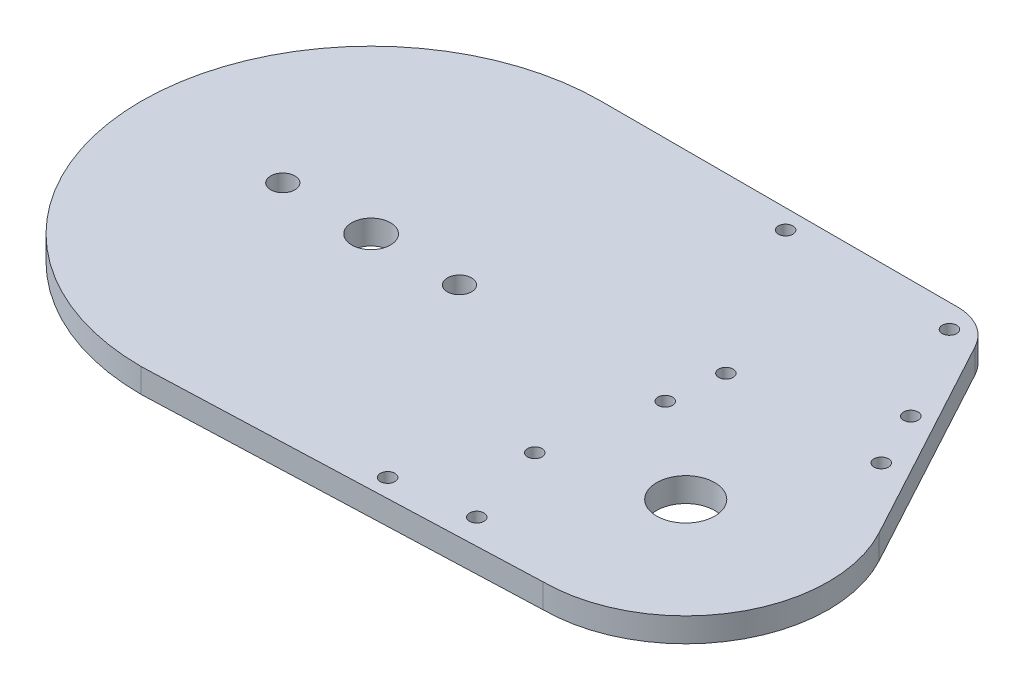
from build123d import *

# Parameters (mm, degrees)
SKETCH1_R           = 4
SKETCH1_R_2         = 1.5
SKETCH1_R_3         = 2.5
SKETCH1_R_4         = 6
BOSS_EXTRUDE1_DEPTH = 5


with BuildPart() as part:
    # Sketch1 → Boss-Extrude1 (new body)
    with BuildSketch(Plane(origin=(0, 0, 0), x_dir=(1, 0, 0), z_dir=(0, 1, 0))):
        with BuildLine():
            Line((0, -47.5), (80, -44.5))
            ThreePointArc((80, -44.5), (105.341650726, -30.101348895), (105.945295539, -0.961067014))
            Line((105.945295539, -0.961067014), (82.559049402, 42.258960334))
            ThreePointArc((82.559049402, 42.258960334), (78.883135286, 46.090390077), (73.764033965, 47.5))
            Line((73.764033965, 47.5), (0, 47.5))
            ThreePointArc((0, 47.5), (-47.5, 0), (0, -47.5))
        make_face()
        Circle(SKETCH1_R, mode=Mode.SUBTRACT)
        with Locations((60.331917451, 0.432644908)):
            Circle(SKETCH1_R_2, mode=Mode.SUBTRACT)
        with Locations((18.25, 0)):
            Circle(SKETCH1_R_3, mode=Mode.SUBTRACT)
        with Locations((-18.25, 0)):
            Circle(SKETCH1_R_3, mode=Mode.SUBTRACT)
        with Locations((80, -15)):
            Circle(SKETCH1_R_4, mode=Mode.SUBTRACT)
        with Locations((76.835494757, 42.654234046)):
            Circle(SKETCH1_R_2, mode=Mode.SUBTRACT)
        with Locations((88.354686129, 23.142870245)):
            Circle(SKETCH1_R_2, mode=Mode.SUBTRACT)
        with Locations((42.137334928, 43.5)):
            Circle(SKETCH1_R_2, mode=Mode.SUBTRACT)
        with Locations((45.293422434, -41.885064382)):
            Circle(SKETCH1_R_2, mode=Mode.SUBTRACT)
        with Locations((61.591696316, 11.71100727)):
            Circle(SKETCH1_R_2, mode=Mode.SUBTRACT)
        with Locations((93.688017257, 11.71100727)):
            Circle(SKETCH1_R_2, mode=Mode.SUBTRACT)
        with Locations((61.591696316, -39.768646015)):
            Circle(SKETCH1_R_2, mode=Mode.SUBTRACT)
        with Locations((56.077168677, -22.259348557)):
            Circle(SKETCH1_R_2, mode=Mode.SUBTRACT)
    extrude(amount=BOSS_EXTRUDE1_DEPTH)


solid = part.part
